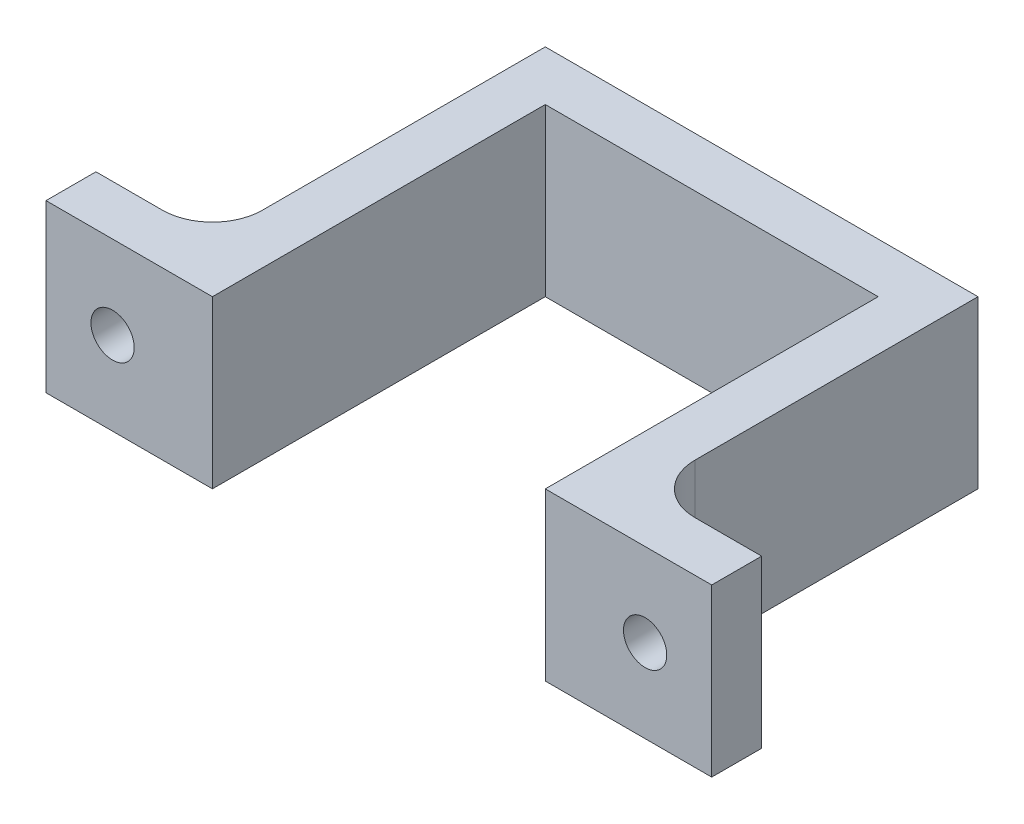
from build123d import *

# Parameters (mm, degrees)
SKETCH_1_W          = 40
SKETCH_1_H          = 23
EXTRUDE_1_DEPTH     = 10
SKETCH_2_W          = 7
SKETCH_2_H          = 20
CUT_EXTRUDE_1_DEPTH = 10
SKETCH_3_W          = 20
SKETCH_3_H          = 20
CUT_EXTRUDE_2_DEPTH = 10
SKETCH_4_R          = 1.3
CUT_EXTRUDE_3_DEPTH = 10
FILLET_1_R          = 3
FILLET_2_R          = 3


with BuildPart() as part:
    # 草图1 → 凸台-拉伸1 (new body)
    with BuildSketch(Plane(origin=(0, 0, 0), x_dir=(1, 0, 0), z_dir=(0, 1, 0))):
        Rectangle(SKETCH_1_W, SKETCH_1_H)
    extrude(amount=EXTRUDE_1_DEPTH)

    # 草图2 → 切除-拉伸1 (cut)
    with BuildSketch(Plane(origin=(0, 10, 0), x_dir=(1, 0, 0), z_dir=(0, 1, 0))):
        with Locations((-16.5, 1.5)):
            Rectangle(SKETCH_2_W, SKETCH_2_H)
        with Locations((16.5, 1.5)):
            Rectangle(SKETCH_2_W, SKETCH_2_H)
    extrude(amount=-CUT_EXTRUDE_1_DEPTH, mode=Mode.SUBTRACT)

    # 草图3 → 切除-拉伸2 (cut)
    with BuildSketch(Plane(origin=(0, 10, 0), x_dir=(1, 0, 0), z_dir=(0, 1, 0))):
        with Locations((0, -1.5)):
            Rectangle(SKETCH_3_W, SKETCH_3_H)
    extrude(amount=-CUT_EXTRUDE_2_DEPTH, mode=Mode.SUBTRACT)

    # 草图4 → 切除-拉伸3 (cut)
    with BuildSketch(Plane(origin=(0, 0, 8.5), x_dir=(-1, 0, 0), z_dir=(0, 0, -1))):
        with Locations((16, 5)):
            Circle(SKETCH_4_R)
        with Locations((-16, 5)):
            Circle(SKETCH_4_R)
    extrude(amount=-CUT_EXTRUDE_3_DEPTH, mode=Mode.SUBTRACT)

    # 圆角1
    # the kernel refuses this fillet: 3 mm, written as the material it adds along each edge
    with BuildSketch(Plane(origin=(13, 10, 8.5), x_dir=(0, 0, -1), z_dir=(0, -1, 0))) as fillet_1_piece_1_section:
        with BuildLine():
            CenterArc((FILLET_1_R, FILLET_1_R), FILLET_1_R, 180, 90)
            Line((0, FILLET_1_R), (0, 0))
            Line((0, 0), (FILLET_1_R, 0))
        make_face()
    fillet_1_piece_1 = extrude(amount=10, mode=Mode.PRIVATE)
    fillet_1_piece_1 = fillet_1_piece_1 - Plane(origin=(16, 5, 7.810677701), x_dir=(-1, 0, 0), z_dir=(0, 0, -1)) * Cylinder(1.3, 32, mode=Mode.PRIVATE)
    add(fillet_1_piece_1)

    # 圆角2
    # the kernel refuses this fillet: 3 mm, written as the material it adds along each edge
    with BuildSketch(Plane(origin=(-13, 10, 8.5), x_dir=(0, 0, -1), z_dir=(0, -1, 0))) as fillet_2_piece_1_section:
        with BuildLine():
            CenterArc((FILLET_2_R, -FILLET_2_R), FILLET_2_R, 90, 90)
            Line((0, -FILLET_2_R), (0, 0))
            Line((0, 0), (FILLET_2_R, 0))
        make_face()
    fillet_2_piece_1 = extrude(amount=10, mode=Mode.PRIVATE)
    fillet_2_piece_1 = fillet_2_piece_1 - Plane(origin=(-16, 5, 7.810678225), x_dir=(-1, 0, 0), z_dir=(0, 0, -1)) * Cylinder(1.3, 32, mode=Mode.PRIVATE)
    add(fillet_2_piece_1)


solid = part.part
